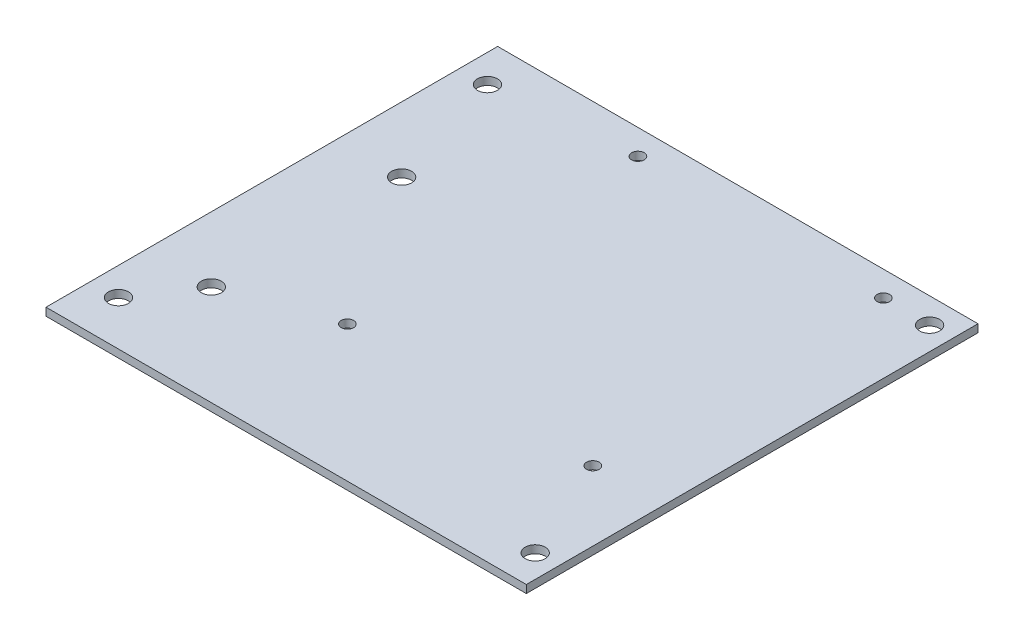
from build123d import *

# Parameters (mm, degrees)
SKETCH1_W               = 96.89
SKETCH1_H               = 90.17
PCB_DEPTH               = 1.57
SKETCH2_R               = 2
M3_MOUNTING_HOLES_DEPTH = 1.57
SKETCH5_W               = 0.5
SKETCH5_H               = 90.17
CUT_EXTRUDE1_DEPTH      = 127.49657684
SKETCH8_R               = 1.25
RPI_MOUNTING_HOLE_DEPTH = 10
SKETCH9_R               = 2
POWERADAPTERHOLES_DEPTH = 10


with BuildPart() as part:
    # Sketch1 → PCB (new body)
    with BuildSketch(Plane(origin=(0, 0, 0), x_dir=(1, 0, 0), z_dir=(0, 1, 0))):
        with Locations((16.200949951, 63.633996534)):
            Rectangle(SKETCH1_W, SKETCH1_H)
    extrude(amount=PCB_DEPTH)

    # Sketch2 → M3 Mounting Holes (cut)
    with BuildSketch(Plane(origin=(0, 1.57, 0), x_dir=(1, 0, 0), z_dir=(0, 1, 0))):
        with Locations((59.565949951, 24.898996534)):
            Circle(SKETCH2_R)
        with Locations((-26.164050049, 27.438996534)):
            Circle(SKETCH2_R)
        with Locations((-26.164050049, 101.098996534)):
            Circle(SKETCH2_R)
        with Locations((59.565949951, 103.638996534)):
            Circle(SKETCH2_R)
    extrude(amount=-M3_MOUNTING_HOLES_DEPTH, mode=Mode.SUBTRACT)

    # Sketch5 → Cut-Extrude1 (cut, through all)
    with BuildSketch(Plane(origin=(0, 1.57, 0), x_dir=(1, 0, 0), z_dir=(0, 1, 0))):
        with Locations((-31.994050049, 63.633996534)):
            Rectangle(SKETCH5_W, SKETCH5_H)
        with Locations((64.395949951, 63.633996534)):
            Rectangle(SKETCH5_W, SKETCH5_H)
    extrude(amount=-CUT_EXTRUDE1_DEPTH, mode=Mode.SUBTRACT)

    # Sketch8 → RPi mounting hole (cut)
    with BuildSketch(Plane(origin=(0, 1.57, 0), x_dir=(1, 0, 0), z_dir=(0, 1, 0))):
        with Locations((1.255949951, 45.718996534)):
            Circle(SKETCH8_R)
        with Locations((50.255949951, 45.718996534)):
            Circle(SKETCH8_R)
        with Locations((1.255949951, 103.718996534)):
            Circle(SKETCH8_R)
        with Locations((50.255949951, 103.718996534)):
            Circle(SKETCH8_R)
    extrude(amount=-RPI_MOUNTING_HOLE_DEPTH, mode=Mode.SUBTRACT)

    # Sketch9 → PowerAdapterHoles (cut)
    with BuildSketch(Plane(origin=(0, 1.57, 0), x_dir=(1, 0, 0), z_dir=(0, 1, 0))):
        with Locations((-18.744050049, 76.548996534)):
            Circle(SKETCH9_R)
        with Locations((-18.744050049, 38.548996534)):
            Circle(SKETCH9_R)
    extrude(amount=-POWERADAPTERHOLES_DEPTH, mode=Mode.SUBTRACT)


solid = part.part
